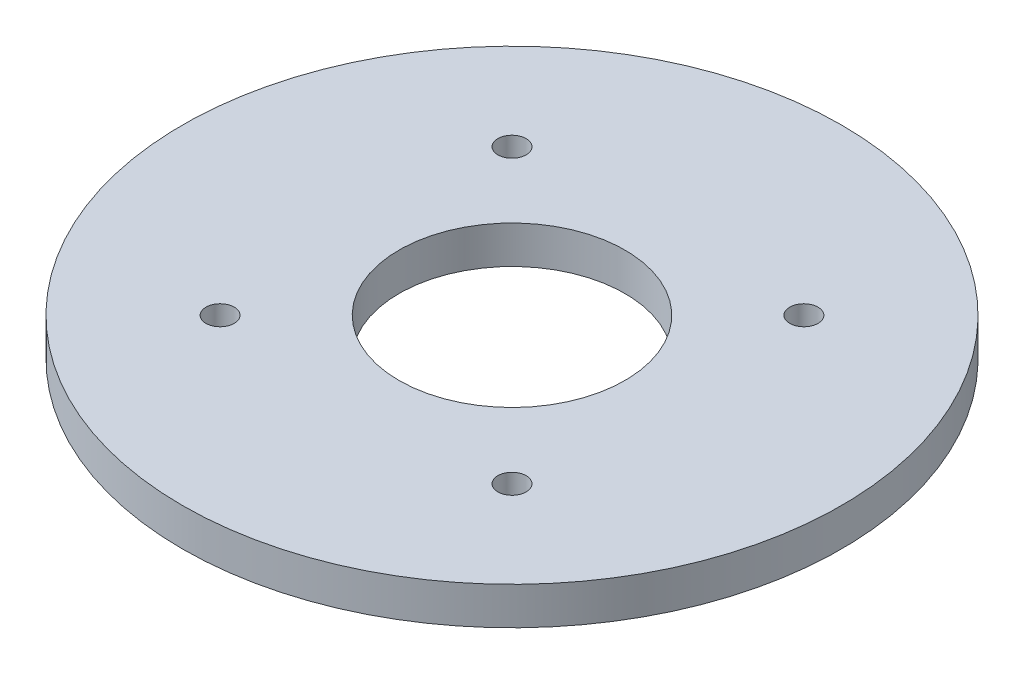
from build123d import *

# Parameters (mm, degrees)
SKETCH2_R           = 35
SKETCH2_R_2         = 12
SKETCH2_R_3         = 1.5
BOSS_EXTRUDE1_DEPTH = 4


with BuildPart() as part:
    # Sketch2 → Boss-Extrude1 (new body)
    with BuildSketch(Plane(origin=(0, -14.246785155, 0), x_dir=(1, 0, 0), z_dir=(0, 1, 0))):
        with Locations((-1.2, 0)):
            Circle(SKETCH2_R)
        with Locations((-1.2, 0)):
            Circle(SKETCH2_R_2, mode=Mode.SUBTRACT)
        with Locations((14.3, 15.5)):
            Circle(SKETCH2_R_3, mode=Mode.SUBTRACT)
        with Locations((-16.7, 15.5)):
            Circle(SKETCH2_R_3, mode=Mode.SUBTRACT)
        with Locations((-16.7, -15.5)):
            Circle(SKETCH2_R_3, mode=Mode.SUBTRACT)
        with Locations((14.3, -15.5)):
            Circle(SKETCH2_R_3, mode=Mode.SUBTRACT)
    extrude(amount=BOSS_EXTRUDE1_DEPTH)


solid = part.part
